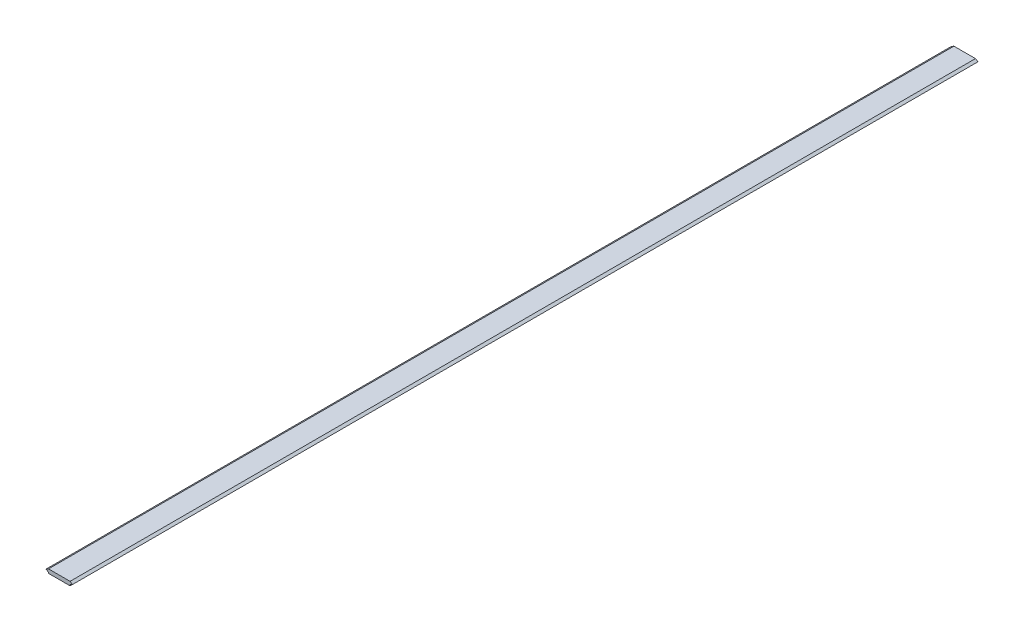
from build123d import *

# Parameters (mm, degrees)
BOSS_EXTRUDE1_DEPTH = 925


with BuildPart() as part:
    # Sketch1 → Boss-Extrude1 (new body)
    with BuildSketch(Plane.XY):
        Polygon((0, 0), (22, 0), (24.598076211, -1.5), (22, -3), (22, -4), (0, -4), (0, -3), (-2.598076211, -1.5), align=None)
    extrude(amount=BOSS_EXTRUDE1_DEPTH)


solid = part.part
